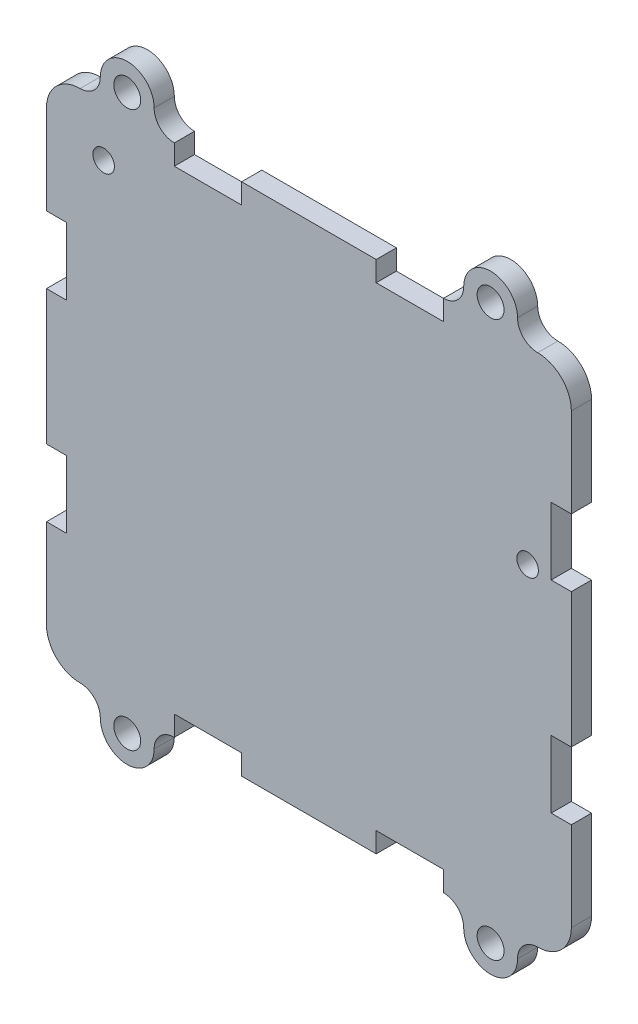
from build123d import *

# Parameters (mm, degrees)
BOSS_EXTRUDE1_DEPTH = 3
SKETCH3_R           = 1.6
CUT_EXTRUDE1_DEPTH  = 3
SKETCH4_W           = 3
SKETCH4_H           = 10
SKETCH4_W_2         = 10
SKETCH4_H_2         = 3
CUT_EXTRUDE2_DEPTH  = 3
SKETCH5_R           = 2
BOSS_EXTRUDE2_DEPTH = 3
FILLET1_R           = 3


with BuildPart() as part:
    # Sketch1 → Boss-Extrude1 (new body)
    with BuildSketch(Plane.XY):
        with BuildLine():
            Line((52, -24), (52, 42.5))
            ThreePointArc((52, 42.5), (50.535533906, 46.035533906), (47, 47.5))
            Line((47, 47.5), (-21, 47.5))
            ThreePointArc((-21, 47.5), (-24.535533906, 46.035533906), (-26, 42.5))
            Line((-26, 42.5), (-26, -24))
            ThreePointArc((-26, -24), (-24.535533906, -27.535533906), (-21, -29))
            Line((-21, -29), (47, -29))
            ThreePointArc((47, -29), (50.535533906, -27.535533906), (52, -24))
        make_face()
    extrude(amount=BOSS_EXTRUDE1_DEPTH)

    # Sketch3 → Cut-Extrude1 (cut)
    with BuildSketch(Plane(origin=(0, 0, 0), x_dir=(-1, 0, 0), z_dir=(0, 0, -1))):
        with Locations((17.5, 40)):
            Circle(SKETCH3_R)
        with Locations((-45.5, 19.5)):
            Circle(SKETCH3_R)
    extrude(amount=-CUT_EXTRUDE1_DEPTH, mode=Mode.SUBTRACT)

    # Sketch4 → Cut-Extrude2 (cut)
    with BuildSketch(Plane(origin=(0, 0, 0), x_dir=(-1, 0, 0), z_dir=(0, 0, -1))):
        with Locations((24.5, 24.25)):
            Rectangle(SKETCH4_W, SKETCH4_H)
        with Locations((24.5, -5.75)):
            Rectangle(SKETCH4_W, SKETCH4_H)
        with Locations((-50.5, -5.75)):
            Rectangle(SKETCH4_W, SKETCH4_H)
        with Locations((-50.5, 24.25)):
            Rectangle(SKETCH4_W, SKETCH4_H)
        with Locations((2, 46)):
            Rectangle(SKETCH4_W_2, SKETCH4_H_2)
        with Locations((-28, 46)):
            Rectangle(SKETCH4_W_2, SKETCH4_H_2)
        with Locations((-28, -27.5)):
            Rectangle(SKETCH4_W_2, SKETCH4_H_2)
        with Locations((2, -27.5)):
            Rectangle(SKETCH4_W_2, SKETCH4_H_2)
    extrude(amount=-CUT_EXTRUDE2_DEPTH, mode=Mode.SUBTRACT)

    # Sketch5 → Boss-Extrude2 (add)
    # profile 1 of 4: a face of its own
    with BuildSketch(Plane.XY.offset(3)):
        with BuildLine():
            Line((-18, 47.5), (-10, 47.5))
            Line((-10, 47.5), (-10, 50.5))
            ThreePointArc((-10, 50.5), (-14, 54.5), (-18, 50.5))
            Line((-18, 50.5), (-18, 47.5))
        make_face()
        with Locations((-14, 50.5)):
            Circle(SKETCH5_R, mode=Mode.SUBTRACT)
    # profile 2 of 4: a face of its own
    with BuildSketch(Plane.XY.offset(3)):
        with BuildLine():
            Line((36, 47.5), (36, 50.5))
            ThreePointArc((36, 50.5), (40, 54.5), (44, 50.5))
            Line((44, 50.5), (44, 47.5))
            Line((44, 47.5), (36, 47.5))
        make_face()
        with Locations(Location((40, 50.5, 0), (0, 0, 180))):
            Circle(SKETCH5_R, mode=Mode.SUBTRACT)
    # profile 3 of 4: a face of its own
    with BuildSketch(Plane.XY.offset(3)):
        with BuildLine():
            Line((44, -29), (36, -29))
            Line((36, -29), (36, -32))
            ThreePointArc((36, -32), (40, -36), (44, -32))
            Line((44, -32), (44, -29))
        make_face()
        with Locations((40, -32)):
            Circle(SKETCH5_R, mode=Mode.SUBTRACT)
    # profile 4 of 4: a face of its own
    with BuildSketch(Plane.XY.offset(3)):
        with BuildLine():
            Line((-10, -29), (-10, -32))
            ThreePointArc((-10, -32), (-14, -36), (-18, -32))
            Line((-18, -32), (-18, -29))
            Line((-18, -29), (-10, -29))
        make_face()
        with Locations(Location((-14, -32, 0), (0, 0, 180))):
            Circle(SKETCH5_R, mode=Mode.SUBTRACT)
    extrude(amount=-BOSS_EXTRUDE2_DEPTH)

    # Fillet1
    fillet1_edges = [part.edges().sort_by_distance(p)[0] for p in [
        (-10, 47.5, 1.5),
        (-18, 47.5, 1.5),
        (36, 47.5, 1.5),
        (44, 47.5, 1.5),
        (44, -29, 1.5),
        (36, -29, 1.5),
        (-10, -29, 1.5),
        (-18, -29, 1.5),
    ]]
    fillet(fillet1_edges, radius=FILLET1_R - 0.0001)  # a hair under: the kernel refuses the full size


solid = part.part
